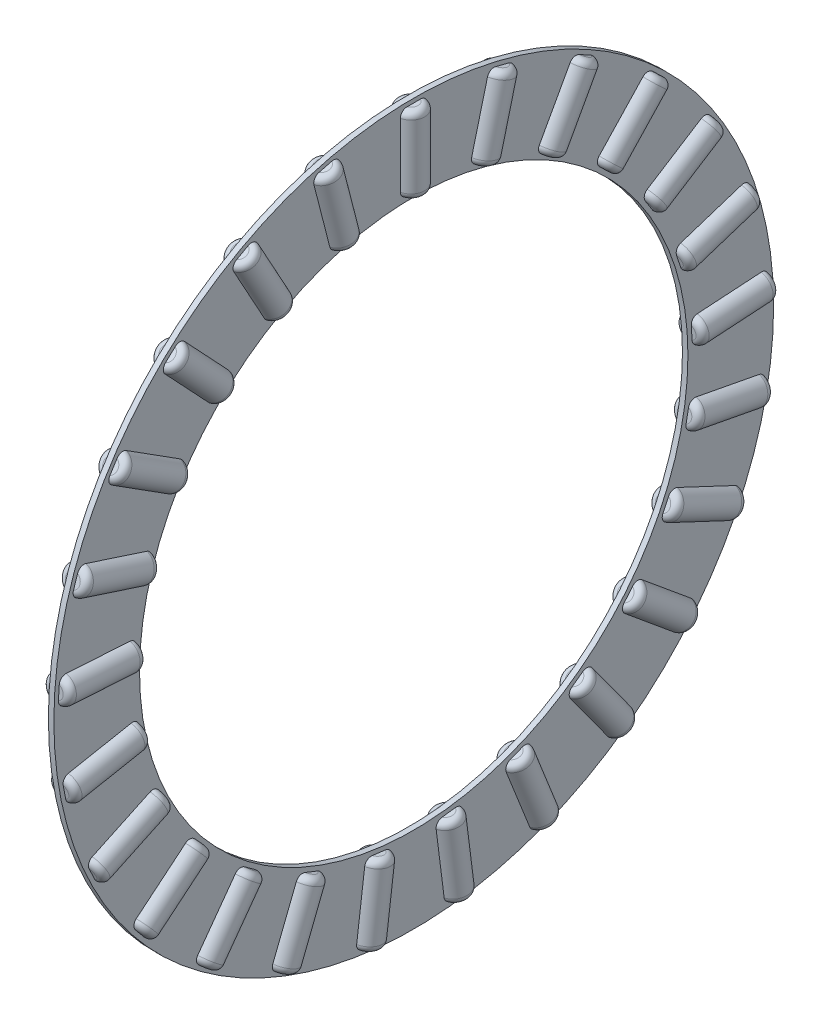
from build123d import *

# Parameters (mm, degrees)
CAGSPISKE_W           = 0.8
CAGSPISKE_H           = 12.5
ROLLERSDETAILED_COUNT = 25
ROLLERSDETAILED_ANGLE = 345.6


with BuildPart() as part:
    # CagSpiSke → CageSpine (revolve)
    with BuildSketch(Plane.XY):
        with Locations((0, 46.25)):
            Rectangle(CAGSPISKE_W, CAGSPISKE_H)
    revolve(axis=Axis((-34.925, 0, 0), (1, 0, 0)))

    # RolDetSke → RollerDetailed (revolve)
    with BuildSketch(Plane.XY):
        with BuildLine():
            Line((0, 51.875), (1.04, 51.875))
            ThreePointArc((1.04, 51.875), (1.71882251, 51.59382251), (2, 50.915))
            Line((2, 50.915), (2, 41.585))
            ThreePointArc((2, 41.585), (1.71882251, 40.90617749), (1.04, 40.625))
            Line((1.04, 40.625), (0, 40.625))
            Line((0, 40.625), (0, 51.875))
        make_face()
    rollerdetailed = revolve(axis=Axis((0, 33.02, 0), (0, 1, 0)))

    # RollersDetailed: RollerDetailed ×25 about axis
    rollersdetailed_axis = Axis((-50, 0, 0), (1, 0, 0))
    for i in range(1, ROLLERSDETAILED_COUNT):
        add(rollerdetailed.rotate(rollersdetailed_axis, i * ROLLERSDETAILED_ANGLE / (ROLLERSDETAILED_COUNT - 1)))


solid = part.part
